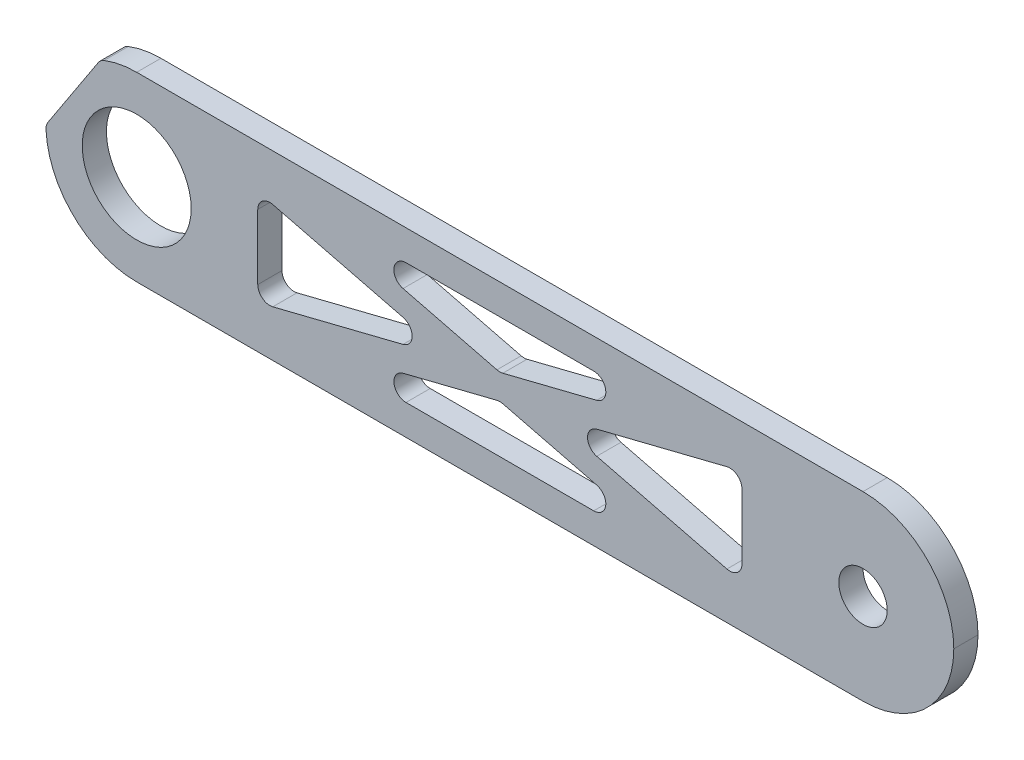
from build123d import *

# Parameters (mm, degrees)
SKETCH_1_W              = 75
SKETCH_1_H              = 15
EXTRUDE_1_DEPTH         = 2
FILLET_1_R              = 7.5
SKETCH_2_R              = 2
SKETCH_2_R_2            = 4.5
CUT_EXTRUDE_1_DEPTH     = 2
CUT_EXTRUDE_2_DEPTH     = 10
FILLET_2_R              = 1
CUT_EXTRUDE_START       = -34
CUT_EXTRUDE_3_OUTLINE_W = 11
CUT_EXTRUDE_3_OUTLINE_H = 4
CUT_EXTRUDE_3_DEPTH     = 2.625249005
FILLET_3_R              = 1


with BuildPart() as part:
    # 草图1 → 凸台-拉伸1 (new body)
    with BuildSketch(Plane.XY):
        Rectangle(SKETCH_1_W, SKETCH_1_H)
    extrude(amount=EXTRUDE_1_DEPTH)

    # 圆角1
    fillet_1_edges = [part.edges().sort_by_distance(p)[0] for p in [
        (37.5, -7.5, 1),
        (-37.5, -7.5, 1),
        (-37.5, 7.5, 1),
        (37.5, 7.5, 1),
    ]]
    fillet(fillet_1_edges, radius=FILLET_1_R - 0.0001)  # a hair under: the kernel refuses the full size

    # 草图2 → 切除-拉伸1 (cut)
    with BuildSketch(Plane.XY.offset(2)):
        with Locations((30, 0)):
            Circle(SKETCH_2_R)
        with Locations((-30, 0)):
            Circle(SKETCH_2_R_2)
    extrude(amount=-CUT_EXTRUDE_1_DEPTH, mode=Mode.SUBTRACT)

    # 草图3 → 切除-拉伸2 (cut)
    with BuildSketch(Plane.XY.offset(2)):
        Polygon((-20, -3.969223594), (-20, 3.969223594), (-4.123105626, 0), align=None)
        Polygon((-15.876894374, 5), (0, 1.030776406), (15.876894374, 5), align=None)
        Polygon((0, -1.030776406), (-15.876894374, -5), (15.876894374, -5), align=None)
        Polygon((4.123105626, 0), (20, -3.969223594), (20, 3.969223594), align=None)
    extrude(amount=-CUT_EXTRUDE_2_DEPTH, mode=Mode.SUBTRACT)

    # 圆角2
    fillet_2_edges = [part.edges().sort_by_distance(p)[0] for p in [
        (-20, -3.969223594, 1),
        (-20, 3.969223594, 1),
        (-4.123105626, 0, 1),
        (0, -1.030776406, 1),
        (15.876894374, -5, 1),
        (-15.876894374, -5, 1),
        (4.123105626, 0, 1),
        (20, 3.969223594, 1),
        (20, -3.969223594, 1),
        (0, 1.030776406, 1),
        (-15.876894374, 5, 1),
        (15.876894374, 5, 1),
    ]]
    fillet(fillet_2_edges, radius=FILLET_2_R)

    # 切除-拉伸3: read off the stored shape, not the designer's step
    # 切除-拉伸3 outline → 切除-拉伸3 (cut)
    with BuildSketch(Plane(origin=(0, 0, 0), x_dir=(0.5477225575051656, 0.8366600265340758, 0), z_dir=(0.8366600265340758, -0.5477225575051659, 0)).offset(CUT_EXTRUDE_START)):
        with Locations((-16.5, 1)):
            Rectangle(CUT_EXTRUDE_3_OUTLINE_W, CUT_EXTRUDE_3_OUTLINE_H)
    extrude(amount=CUT_EXTRUDE_3_DEPTH, mode=Mode.SUBTRACT)

    # 圆角3
    fillet_3_edges = [part.edges().sort_by_distance(p)[0] for p in [
        (-32.999968349, 6.87391189, 1),
        (-37.5, 0, 1),
    ]]
    fillet(fillet_3_edges, radius=FILLET_3_R)


solid = part.part
